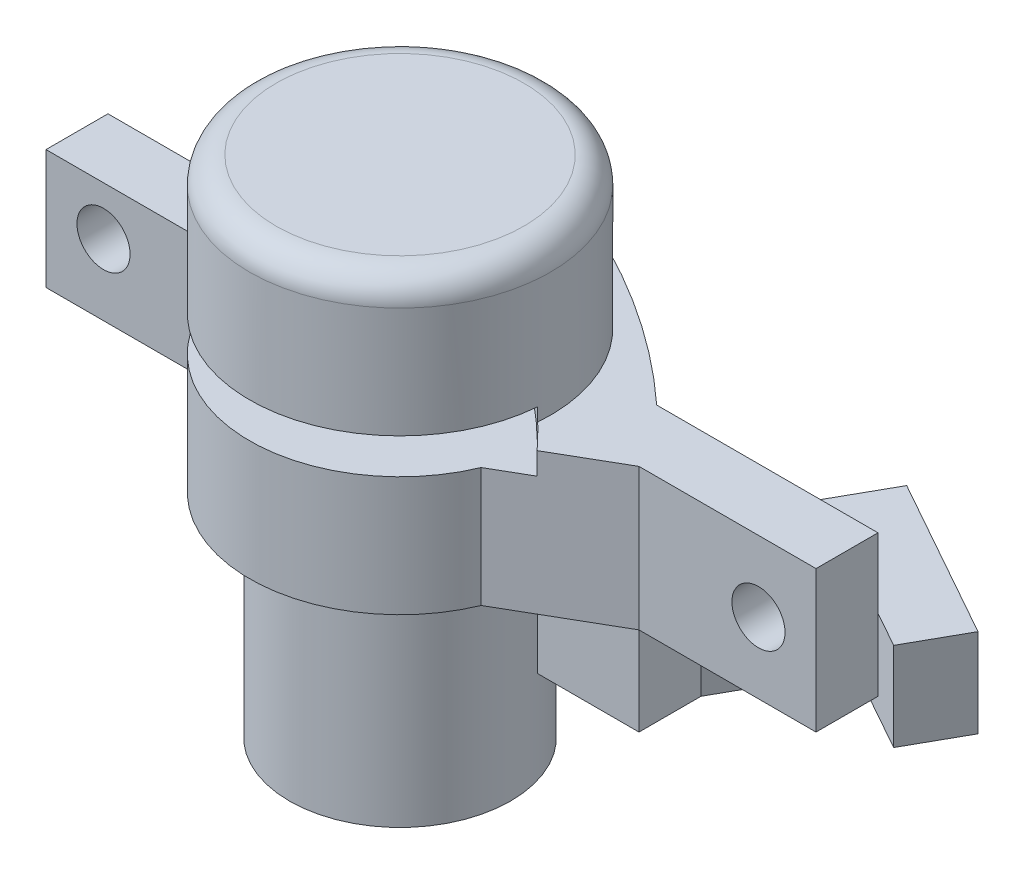
from build123d import *

# Parameters (mm, degrees)
BOSS_EXTRUDE1_DEPTH = 16
SKETCH2_R           = 17
BOSS_EXTRUDE2_DEPTH = 17
SKETCH3_R           = 12.5
BOSS_EXTRUDE3_DEPTH = 24
SKETCH4_R           = 3
CUT_EXTRUDE1_DEPTH  = 97.093704268
BOSS_EXTRUDE5_DEPTH = 10
SKETCH7_R           = 82
CUT_EXTRUDE2_DEPTH  = 4
FILLET1_R           = 3


with BuildPart() as part:
    # Sketch1 → Boss-Extrude1 (new body)
    with BuildSketch(Plane(origin=(0, 0, 0), x_dir=(1, 0, 0), z_dir=(0, 1, 0))):
        with BuildLine():
            Line((0, 0), (23, 0))
            ThreePointArc((23, 0), (36.672989813, -16.671262796), (55.697765084, -6.525348371))
            Line((55.697765084, -6.525348371), (67, 0))
            Line((67, 0), (87, 0))
            Line((87, 0), (87, 7))
            Line((87, 7), (62, 7))
            ThreePointArc((62, 7), (45.688374241, 18.635635799), (26.997081597, 25.853165477))
            ThreePointArc((26.997081597, 25.853165477), (22.544359958, 24.799758331), (20.813284408, 20.564221286))
            Line((20.813284408, 20.564221286), (22, 7))
            Line((22, 7), (0, 7))
            Line((0, 7), (0, 0))
        make_face()
    extrude(amount=BOSS_EXTRUDE1_DEPTH)

    # Sketch2 → Boss-Extrude2 (add)
    with BuildSketch(Plane(origin=(0, 16, 0), x_dir=(1, 0, 0), z_dir=(0, 1, 0))):
        with Locations((40, 0)):
            Circle(SKETCH2_R)
    extrude(amount=BOSS_EXTRUDE2_DEPTH)

    # Sketch3 → Boss-Extrude3 (add)
    with BuildSketch(Plane.XZ):
        with Locations((40, 0)):
            Circle(SKETCH3_R)
    extrude(amount=BOSS_EXTRUDE3_DEPTH)

    # Sketch4 → Cut-Extrude1 (cut, through all)
    with BuildSketch(Plane(origin=(0, 0, -7), x_dir=(-1, 0, 0), z_dir=(0, 0, -1))):
        with Locations((-80.5, 8)):
            Circle(SKETCH4_R)
        with Locations((-6.5, 8)):
            Circle(SKETCH4_R)
    extrude(amount=-CUT_EXTRUDE1_DEPTH, mode=Mode.SUBTRACT)

    # Sketch5 → Boss-Extrude5 (add)
    with BuildSketch(Plane(origin=(0, 0, 0), x_dir=(1, 0, 0), z_dir=(0, 1, 0))):
        Polygon((67, 7), (73.302829045, 18.25023255), (82.899413644, 12.873843052), (86.320752416, 18.980760523), (68, 29.244776839), (55.512272379, 6.954811689), (55.512272379, 0), (67, 0), align=None)
    extrude(amount=-BOSS_EXTRUDE5_DEPTH)

    # Sketch7 → Cut-Extrude2 (cut)
    with BuildSketch(Plane(origin=(0, 13.5, 0), x_dir=(1, 0, 0), z_dir=(0, 1, 0))):
        with Locations((-0.4, -60)):
            Circle(SKETCH7_R)
    extrude(amount=CUT_EXTRUDE2_DEPTH, mode=Mode.SUBTRACT)

    # Fillet1
    fillet1_edges = [part.edges().sort_by_distance(p)[0] for p in [
        (23, 33, 0),
    ]]
    fillet(fillet1_edges, radius=FILLET1_R)


solid = part.part
